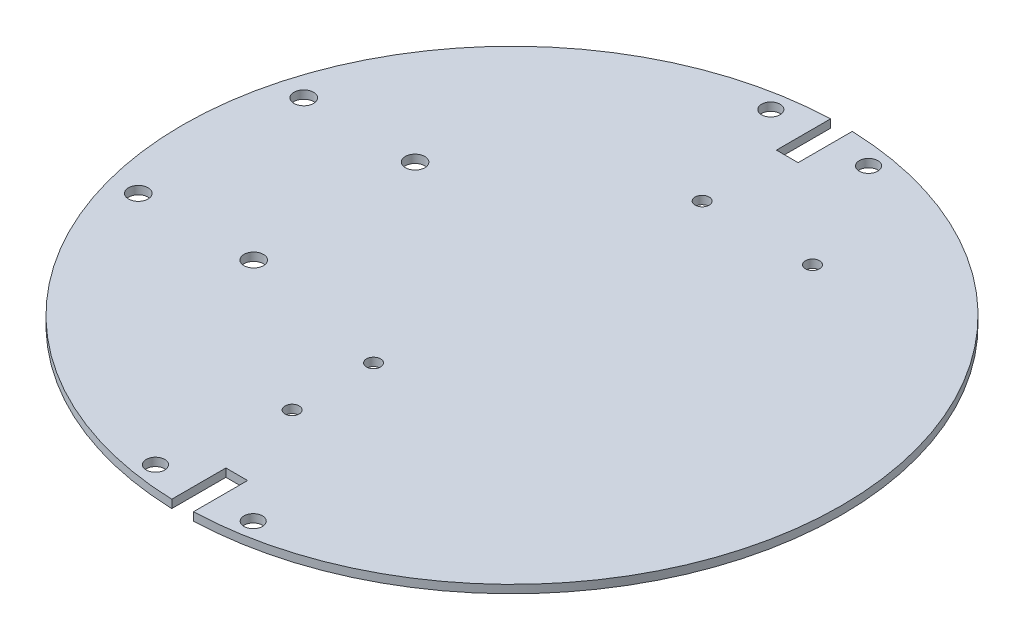
from build123d import *

# Parameters (mm, degrees)
SKETCH1_R            = 60.7
BOSS_EXTRUDE1_DEPTH  = 1.5
M2_CLEARANCE_HOLE1_D = 2.6
M3_CLEARANCE_HOLE2_D = 3.6
SKETCH23_W           = 4
SKETCH23_H           = 10
CUT_EXTRUDE1_DEPTH   = 10
M3_CLEARANCE_HOLE3_D = 3.4
MIRROR1_COPY_1_D     = 3.4


with BuildPart() as part:
    # Sketch1 → Boss-Extrude1 (new body)
    with BuildSketch(Plane(origin=(0, 0, 0), x_dir=(1, 0, 0), z_dir=(0, 1, 0))):
        Circle(SKETCH1_R)
    extrude(amount=BOSS_EXTRUDE1_DEPTH)

    # M2 Clearance Hole1 (through all)
    with Locations(Plane(origin=(0, 1.5, 0), x_dir=(1, 0, 0), z_dir=(0, 1, 0))):
        with Locations((-0.709999951, 35.730000111), (19.610000128, 35.730000136), (-5.154, -20.350313806), (-5.154, -35.350313806)):
            Hole(M2_CLEARANCE_HOLE1_D / 2)

    # M3 Clearance Hole2 (through all)
    with Locations(Plane(origin=(0, 1.5, 0), x_dir=(1, 0, 0), z_dir=(0, 1, 0))):
        with Locations((-53.86454119, 15.511690642), (-53.864546519, -14.968309358), (-32.604546519, -14.968313075), (-33.36654119, 15.511687058)):
            Hole(M3_CLEARANCE_HOLE2_D / 2)

    # Sketch23 → Cut-Extrude1 (cut)
    with BuildSketch(Plane(origin=(0, 1.5, 0), x_dir=(1, 0, 0), z_dir=(0, 1, 0))):
        with Locations((0, 55.7)):
            Rectangle(SKETCH23_W, SKETCH23_H)
    cut_extrude1 = extrude(amount=-CUT_EXTRUDE1_DEPTH, mode=Mode.SUBTRACT)

    # M3 Clearance Hole3 (through all)
    with Locations(Plane(origin=(0, 1.5, 0), x_dir=(1, 0, 0), z_dir=(0, 1, 0))):
        with Locations((9, 56.667042123)):
            m3_clearance_hole3 = Hole(M3_CLEARANCE_HOLE3_D / 2)

    # Mirror2: M3 Clearance Hole3 across plane
    add(m3_clearance_hole3.mirror(Plane(origin=(0, 0, 0), x_dir=(0, 0, 1), z_dir=(1, 0, 0))), mode=Mode.SUBTRACT)

    # Mirror1: Cut-Extrude1, M3 Clearance Hole3 across plane
    add(cut_extrude1.mirror(Plane.XY), mode=Mode.SUBTRACT)
    add(m3_clearance_hole3.mirror(Plane.XY), mode=Mode.SUBTRACT)

    # Mirror1 copy 1 (through all)
    with Locations(Plane(origin=(0, 1.5, 0), x_dir=(-1, 0, 0), z_dir=(0, 1, 0))):
        with Locations((9, 56.667042123)):
            Hole(MIRROR1_COPY_1_D / 2)


solid = part.part
